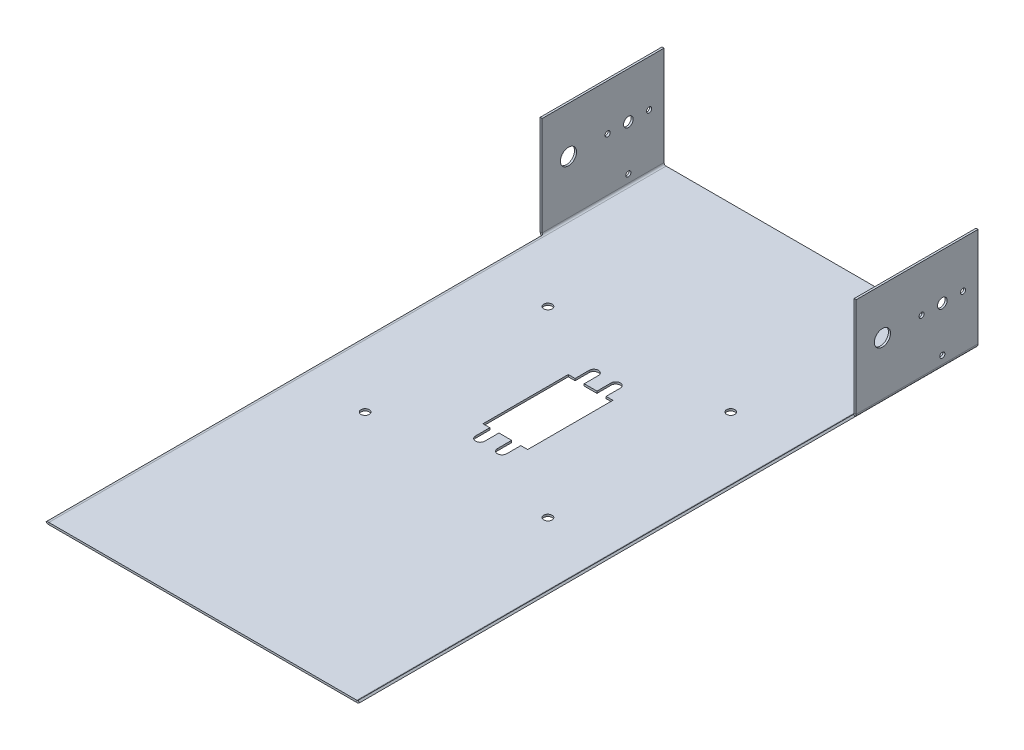
from build123d import *

# Parameters (mm, degrees)
SKETCH1_W                    = 154
SKETCH1_H                    = 304
BASE_FLANGE1_DEPTH           = 1
SKETCH4_W                    = 22
SKETCH4_H                    = 42
CUT_EXTRUDE3_DEPTH           = 10
MIRROR2_COPY_1_SKETCH_W      = 22
MIRROR2_COPY_1_SKETCH_H      = 42
MIRROR2_COPY_1_DEPTH         = 10
SKETCH2_R                    = 2.05
CUT_EXTRUDE4_DEPTH           = 10
SKETCH10_W                   = 50
SKETCH10_H                   = 60
BOSS_EXTRUDE2_DEPTH          = 1
SKETCH11_R                   = 3.975
SKETCH11_R_2                 = 1.27
SKETCH11_R_3                 = 2.375
CUT_EXTRUDE6_DEPTH           = 1
SKETCH12_R                   = 1.27
CUT_EXTRUDE7_DEPTH           = 1
SKETCH13_R                   = 3.975
SKETCH13_R_2                 = 1.27
SKETCH13_R_3                 = 2.375
CUT_EXTRUDE8_DEPTH           = 1
SKETCHED_START               = -127
SKETCHED_BEND1_OUTLINE_W     = 1
SKETCHED_BEND1_OUTLINE_H     = 60
SKETCHED_BEND1_DEPTH         = 49.366857245
SKETCHED_START_2             = -77.689070906
SKETCHED_BEND1_2_OUTLINE_W   = 49.821902755
SKETCHED_BEND1_2_OUTLINE_H   = 60
SKETCHED_BEND1_2_OUTLINE_R   = 1.27
SKETCHED_BEND1_2_OUTLINE_R_2 = 2.375
SKETCHED_BEND1_2_OUTLINE_R_3 = 3.975
SKETCHED_BEND1_2_DEPTH       = 0.867168151
SKETCHED_START_3             = -77
SKETCHED_BEND1_3_OUTLINE_W   = 49.821902755
SKETCHED_BEND1_3_OUTLINE_H   = 60
SKETCHED_BEND1_3_OUTLINE_R   = 1.27
SKETCHED_BEND1_3_OUTLINE_R_2 = 2.375
SKETCHED_BEND1_3_OUTLINE_R_3 = 3.975
SKETCHED_BEND1_3_DEPTH       = 1.178097245
SKETCHED_START_4             = -77.821902755
SKETCHED_BEND1_4_OUTLINE_W   = 49.821902755
SKETCHED_BEND1_4_OUTLINE_H   = 60
SKETCHED_BEND1_4_OUTLINE_R   = 1.27
SKETCHED_BEND1_4_OUTLINE_R_2 = 2.375
SKETCHED_BEND1_4_OUTLINE_R_3 = 3.975
SKETCHED_BEND1_4_DEPTH       = 0.132831849
SKETCHED_START_5             = -35
SKETCHED_BEND1_5_DEPTH       = 304.655376963
SKETCHED_START_6             = 25.655376963
SKETCHED_BEND1_6_DEPTH       = 244
SKETCHED_BEND1_7_DEPTH       = 244
SKETCHED_START_7             = 77.616422755
SKETCHED_BEND2_OUTLINE_W     = 1
SKETCHED_BEND2_OUTLINE_H     = 60
SKETCHED_BEND2_DEPTH         = 49.383577245
SKETCHED_START_8             = 76.821902755
SKETCHED_BEND2_2_OUTLINE_W   = 49.821902755
SKETCHED_BEND2_2_OUTLINE_H   = 60
SKETCHED_BEND2_2_OUTLINE_R   = 1.27
SKETCHED_BEND2_2_OUTLINE_R_2 = 2.375
SKETCHED_BEND2_2_OUTLINE_R_3 = 3.975
SKETCHED_BEND2_2_DEPTH       = 0.414213562
SKETCHED_START_9             = 75.821902755
SKETCHED_BEND2_3_OUTLINE_W   = 49.821902755
SKETCHED_BEND2_3_OUTLINE_H   = 60
SKETCHED_BEND2_3_OUTLINE_R   = 1.27
SKETCHED_BEND2_3_OUTLINE_R_2 = 2.375
SKETCHED_BEND2_3_OUTLINE_R_3 = 3.975
SKETCHED_BEND2_3_DEPTH       = 2
SKETCHED_BEND2_4_DEPTH       = 304.655376963
SKETCHED_BEND2_5_DEPTH       = 244
SKETCHED_BEND2_6_DEPTH       = 244


with BuildPart() as part:
    # Base-Flange1: sheet metal written as solids
    # Sketch1 → Base-Flange1 (new body)
    with BuildSketch(Plane(origin=(0, 0, 0), x_dir=(1, 0, 0), z_dir=(0, 1, 0))):
        with Locations((0, -117.655376963)):
            Rectangle(SKETCH1_W, SKETCH1_H)
    extrude(amount=-BASE_FLANGE1_DEPTH)

    # Sketch4 → Cut-Extrude3 (cut)
    with BuildSketch(Plane(origin=(0, 0, 0), x_dir=(1, 0, 0), z_dir=(0, 1, 0))):
        with Locations((0, -99.655376963)):
            Rectangle(SKETCH4_W, SKETCH4_H)
        with BuildLine():
            Line((-7.634176778, -85.655376963), (-7.634176778, -71.655376963))
            ThreePointArc((-7.634176778, -71.655376963), (-5.384176778, -69.405376963), (-3.134176778, -71.655376963))
            Line((-3.134176778, -71.655376963), (-3.134176778, -85.655376963))
            ThreePointArc((-3.134176778, -85.655376963), (-5.384176778, -87.905376963), (-7.634176778, -85.655376963))
        make_face()
    cut_extrude3 = extrude(amount=-CUT_EXTRUDE3_DEPTH, mode=Mode.SUBTRACT)

    # Mirror1: Cut-Extrude3 across plane
    add(cut_extrude3.mirror(Plane(origin=(0, 0, 0), x_dir=(0, 0, 1), z_dir=(1, 0, 0))), mode=Mode.SUBTRACT)

    # Mirror2: Cut-Extrude3 across plane
    add(cut_extrude3.mirror(Plane(origin=(0, 0, 99.655376963), x_dir=(1, 0, 0), z_dir=(0, 0, -1))), mode=Mode.SUBTRACT)

    # Mirror2 copy 1 sketch → Mirror2 copy 1 (cut)
    with BuildSketch(Plane(origin=(0, 0, 199.310753926), x_dir=(-1, 0, 0), z_dir=(0, 1, 0))):
        with Locations((0, -99.655376963)):
            Rectangle(MIRROR2_COPY_1_SKETCH_W, MIRROR2_COPY_1_SKETCH_H)
        with BuildLine():
            Line((-7.634176778, -85.655376963), (-7.634176778, -71.655376963))
            ThreePointArc((-7.634176778, -71.655376963), (-5.384176778, -69.405376963), (-3.134176778, -71.655376963))
            Line((-3.134176778, -71.655376963), (-3.134176778, -85.655376963))
            ThreePointArc((-3.134176778, -85.655376963), (-5.384176778, -87.905376963), (-7.634176778, -85.655376963))
        make_face()
    extrude(amount=-MIRROR2_COPY_1_DEPTH, mode=Mode.SUBTRACT)

    # Sketch2 → Cut-Extrude4 (cut)
    with BuildSketch(Plane(origin=(0, 0, 0), x_dir=(1, 0, 0), z_dir=(0, 1, 0))):
        with Locations(Location((-45.02, -144.67537696, 0), (0, 0, 270))):
            Circle(SKETCH2_R)
        with Locations(Location((-45.02, -54.63537696, 0), (0, 0, 270))):
            Circle(SKETCH2_R)
        with Locations(Location((45.02, -54.63537696, 0), (0, 0, 270))):
            Circle(SKETCH2_R)
        with Locations(Location((45.02, -144.67537696, 0), (0, 0, 270))):
            Circle(SKETCH2_R)
    extrude(amount=-CUT_EXTRUDE4_DEPTH, mode=Mode.SUBTRACT)

    # Sketch10 → Boss-Extrude2 (add)
    with BuildSketch(Plane(origin=(0, 0, 0), x_dir=(1, 0, 0), z_dir=(0, 1, 0))):
        with Locations((-102, 4.344623037)):
            Rectangle(SKETCH10_W, SKETCH10_H)
        with Locations((102, 4.344623037)):
            Rectangle(SKETCH10_W, SKETCH10_H)
    extrude(amount=-BOSS_EXTRUDE2_DEPTH)

    # Sketch11 → Cut-Extrude6 (cut)
    with BuildSketch(Plane(origin=(0, 0, 0), x_dir=(1, 0, 0), z_dir=(0, 1, 0))):
        with Locations(Location((104.29, -12.725376963, 0), (0, 0, 270))):
            Circle(SKETCH11_R)
        with Locations(Location((104.29, 6.564623037, 0), (0, 0, 270))):
            Circle(SKETCH11_R_2)
        with Locations(Location((104.29, 16.774623037, 0), (0, 0, 270))):
            Circle(SKETCH11_R_3)
        with Locations(Location((104.29, 26.984623037, 0), (0, 0, 270))):
            Circle(SKETCH11_R_2)
    extrude(amount=-CUT_EXTRUDE6_DEPTH, mode=Mode.SUBTRACT)

    # Sketch12 → Cut-Extrude7 (cut)
    with BuildSketch(Plane(origin=(0, 0, 0), x_dir=(1, 0, 0), z_dir=(0, 1, 0))):
        with Locations(Location((82.12, 16.774623037, 0), (0, 0, 270))):
            Circle(SKETCH12_R)
    extrude(amount=-CUT_EXTRUDE7_DEPTH, mode=Mode.SUBTRACT)

    # Sketch13 → Cut-Extrude8 (cut)
    with BuildSketch(Plane(origin=(0, 0, 0), x_dir=(1, 0, 0), z_dir=(0, 1, 0))):
        with Locations(Location((-104.29, -12.725376963, 0), (0, 0, 270))):
            Circle(SKETCH13_R)
        with Locations(Location((-104.29, 6.564623037, 0), (0, 0, 270))):
            Circle(SKETCH13_R_2)
        with Locations(Location((-104.29, 16.774623037, 0), (0, 0, 270))):
            Circle(SKETCH13_R_3)
        with Locations(Location((-82.12, 16.774623037, 0), (0, 0, 270))):
            Circle(SKETCH13_R_2)
        with Locations(Location((-104.29, 26.984623037, 0), (0, 0, 270))):
            Circle(SKETCH13_R_2)
    extrude(amount=-CUT_EXTRUDE8_DEPTH, mode=Mode.SUBTRACT)

    # Sketched Bend1: read off the stored shape, not the designer's step
    # Sketched Bend1 outline → Sketched Bend1 (cut)
    with BuildSketch(Plane.YZ.offset(SKETCHED_START)):
        with Locations((-0.5, -4.344623037)):
            Rectangle(SKETCHED_BEND1_OUTLINE_W, SKETCHED_BEND1_OUTLINE_H)
    extrude(amount=SKETCHED_BEND1_DEPTH, mode=Mode.SUBTRACT)

    # Sketched Bend1 2 outline → Sketched Bend1 2 (add)
    with BuildSketch(Plane.YZ.offset(SKETCHED_START_2)):
        with Locations((24.910951378, -4.344623037)):
            Rectangle(SKETCHED_BEND1_2_OUTLINE_W, SKETCHED_BEND1_2_OUTLINE_H)
        with Locations((4.941902755, -16.774623037)):
            Circle(SKETCHED_BEND1_2_OUTLINE_R, mode=Mode.SUBTRACT)
        with Locations((27.111902755, -26.984623037)):
            Circle(SKETCHED_BEND1_2_OUTLINE_R, mode=Mode.SUBTRACT)
        with Locations((27.111902755, -16.774623037)):
            Circle(SKETCHED_BEND1_2_OUTLINE_R_2, mode=Mode.SUBTRACT)
        with Locations((27.111902755, -6.564623037)):
            Circle(SKETCHED_BEND1_2_OUTLINE_R, mode=Mode.SUBTRACT)
        with Locations((27.111902755, 12.725376963)):
            Circle(SKETCHED_BEND1_2_OUTLINE_R_3, mode=Mode.SUBTRACT)
    extrude(amount=SKETCHED_BEND1_2_DEPTH)

    # Sketched Bend1 3 outline → Sketched Bend1 3 (add)
    with BuildSketch(Plane.YZ.offset(SKETCHED_START_3)):
        with Locations((24.910951378, -4.344623037)):
            Rectangle(SKETCHED_BEND1_3_OUTLINE_W, SKETCHED_BEND1_3_OUTLINE_H)
        with Locations((4.941902755, -16.774623037)):
            Circle(SKETCHED_BEND1_3_OUTLINE_R, mode=Mode.SUBTRACT)
        with Locations((27.111902755, -26.984623037)):
            Circle(SKETCHED_BEND1_3_OUTLINE_R, mode=Mode.SUBTRACT)
        with Locations((27.111902755, -16.774623037)):
            Circle(SKETCHED_BEND1_3_OUTLINE_R_2, mode=Mode.SUBTRACT)
        with Locations((27.111902755, -6.564623037)):
            Circle(SKETCHED_BEND1_3_OUTLINE_R, mode=Mode.SUBTRACT)
        with Locations((27.111902755, 12.725376963)):
            Circle(SKETCHED_BEND1_3_OUTLINE_R_3, mode=Mode.SUBTRACT)
    extrude(amount=SKETCHED_BEND1_3_DEPTH)

    # Sketched Bend1 4 outline → Sketched Bend1 4 (add)
    with BuildSketch(Plane.YZ.offset(SKETCHED_START_4)):
        with Locations((24.910951378, -4.344623037)):
            Rectangle(SKETCHED_BEND1_4_OUTLINE_W, SKETCHED_BEND1_4_OUTLINE_H)
        with Locations((4.941902755, -16.774623037)):
            Circle(SKETCHED_BEND1_4_OUTLINE_R, mode=Mode.SUBTRACT)
        with Locations((27.111902755, -26.984623037)):
            Circle(SKETCHED_BEND1_4_OUTLINE_R, mode=Mode.SUBTRACT)
        with Locations((27.111902755, -16.774623037)):
            Circle(SKETCHED_BEND1_4_OUTLINE_R_2, mode=Mode.SUBTRACT)
        with Locations((27.111902755, -6.564623037)):
            Circle(SKETCHED_BEND1_4_OUTLINE_R, mode=Mode.SUBTRACT)
        with Locations((27.111902755, 12.725376963)):
            Circle(SKETCHED_BEND1_4_OUTLINE_R_3, mode=Mode.SUBTRACT)
    extrude(amount=SKETCHED_BEND1_4_DEPTH)

    # Sketched Bend1 5 outline → Sketched Bend1 5 (cut)
    with BuildSketch(Plane.XY.offset(SKETCHED_START_5)):
        with BuildLine():
            Line((-76.821902755, 49.821902755), (-76.821902755, 1))
            ThreePointArc((-76.821902755, 1), (-76.529009536, 0.292893219), (-75.821902755, 0))
            Line((-75.821902755, 0), (-75.821902755, 49.821902755))
            Line((-75.821902755, 49.821902755), (-76.821902755, 49.821902755))
        make_face()
        with BuildLine():
            Line((-77.821902755, 1), (-77.821902755, 0))
            Line((-77.821902755, 0), (-77.633142755, 0))
            Line((-77.633142755, 0), (-77.633142755, -1))
            Line((-77.633142755, -1), (-75.821902755, -1))
            ThreePointArc((-75.821902755, -1), (-77.236116317, -0.414213562), (-77.821902755, 1))
        make_face()
    extrude(amount=SKETCHED_BEND1_5_DEPTH, mode=Mode.SUBTRACT)

    # Sketched Bend1 6 outline → Sketched Bend1 6 (cut)
    with BuildSketch(Plane.XY.offset(SKETCHED_START_6)):
        Polygon((-77, -0.178097245), (-76.821902755, 0), (-77, 0), align=None)
    extrude(amount=SKETCHED_BEND1_6_DEPTH, mode=Mode.SUBTRACT)

    # Sketched Bend1 7 outline → Sketched Bend1 7 (add)
    with BuildSketch(Plane.XY.offset(SKETCHED_START_6)):
        with BuildLine():
            ThreePointArc((-75.821902755, 0), (-76.204586187, 0.076120468), (-76.529009536, 0.292893219))
            Line((-76.529009536, 0.292893219), (-76.821902755, 0))
            Line((-76.821902755, 0), (-75.821902755, 0))
        make_face()
        with BuildLine():
            Line((-77, -0.616195186), (-77, -0.178097245))
            Line((-77, -0.178097245), (-77.236116317, -0.414213562))
            ThreePointArc((-77.236116317, -0.414213562), (-77.121986588, -0.519796705), (-77, -0.616195186))
        make_face()
    extrude(amount=SKETCHED_BEND1_7_DEPTH)

    # Sketched Bend2: read off the stored shape, not the designer's step
    # Sketched Bend2 outline → Sketched Bend2 (cut)
    with BuildSketch(Plane.YZ.offset(SKETCHED_START_7)):
        with Locations((-0.5, -4.344623037)):
            Rectangle(SKETCHED_BEND2_OUTLINE_W, SKETCHED_BEND2_OUTLINE_H)
    extrude(amount=SKETCHED_BEND2_DEPTH, mode=Mode.SUBTRACT)

    # Sketched Bend2 2 outline → Sketched Bend2 2 (add)
    with BuildSketch(Plane.YZ.offset(SKETCHED_START_8)):
        with Locations((24.910951378, -4.344623037)):
            Rectangle(SKETCHED_BEND2_2_OUTLINE_W, SKETCHED_BEND2_2_OUTLINE_H)
        with Locations((4.941902755, -16.774623037)):
            Circle(SKETCHED_BEND2_2_OUTLINE_R, mode=Mode.SUBTRACT)
        with Locations((27.111902755, -26.984623037)):
            Circle(SKETCHED_BEND2_2_OUTLINE_R, mode=Mode.SUBTRACT)
        with Locations((27.111902755, -16.774623037)):
            Circle(SKETCHED_BEND2_2_OUTLINE_R_2, mode=Mode.SUBTRACT)
        with Locations((27.111902755, -6.564623037)):
            Circle(SKETCHED_BEND2_2_OUTLINE_R, mode=Mode.SUBTRACT)
        with Locations((27.111902755, 12.725376963)):
            Circle(SKETCHED_BEND2_2_OUTLINE_R_3, mode=Mode.SUBTRACT)
    extrude(amount=SKETCHED_BEND2_2_DEPTH)

    # Sketched Bend2 3 outline → Sketched Bend2 3 (add)
    with BuildSketch(Plane.YZ.offset(SKETCHED_START_9)):
        with Locations((24.910951378, -4.344623037)):
            Rectangle(SKETCHED_BEND2_3_OUTLINE_W, SKETCHED_BEND2_3_OUTLINE_H)
        with Locations((4.941902755, -16.774623037)):
            Circle(SKETCHED_BEND2_3_OUTLINE_R, mode=Mode.SUBTRACT)
        with Locations((27.111902755, -26.984623037)):
            Circle(SKETCHED_BEND2_3_OUTLINE_R, mode=Mode.SUBTRACT)
        with Locations((27.111902755, -16.774623037)):
            Circle(SKETCHED_BEND2_3_OUTLINE_R_2, mode=Mode.SUBTRACT)
        with Locations((27.111902755, -6.564623037)):
            Circle(SKETCHED_BEND2_3_OUTLINE_R, mode=Mode.SUBTRACT)
        with Locations((27.111902755, 12.725376963)):
            Circle(SKETCHED_BEND2_3_OUTLINE_R_3, mode=Mode.SUBTRACT)
    extrude(amount=SKETCHED_BEND2_3_DEPTH)

    # Sketched Bend2 4 outline → Sketched Bend2 4 (cut)
    with BuildSketch(Plane.XY.offset(SKETCHED_START_5)):
        with BuildLine():
            ThreePointArc((77.821902755, 1), (77.236116317, -0.414213562), (75.821902755, -1))
            Line((75.821902755, -1), (77.616422755, -1))
            Line((77.616422755, -1), (77.616422755, 0))
            Line((77.616422755, 0), (77.821902755, 0))
            Line((77.821902755, 0), (77.821902755, 1))
        make_face()
        with BuildLine():
            ThreePointArc((75.821902755, 0), (76.529009536, 0.292893219), (76.821902755, 1))
            Line((76.821902755, 1), (76.821902755, 49.821902755))
            Line((76.821902755, 49.821902755), (75.821902755, 49.821902755))
            Line((75.821902755, 49.821902755), (75.821902755, 0))
        make_face()
    extrude(amount=SKETCHED_BEND2_4_DEPTH, mode=Mode.SUBTRACT)

    # Sketched Bend2 5 outline → Sketched Bend2 5 (cut)
    with BuildSketch(Plane.XY.offset(SKETCHED_START_6)):
        Polygon((76.821902755, 0), (77, -0.178097245), (77, 0), align=None)
    extrude(amount=SKETCHED_BEND2_5_DEPTH, mode=Mode.SUBTRACT)

    # Sketched Bend2 6 outline → Sketched Bend2 6 (add)
    with BuildSketch(Plane.XY.offset(SKETCHED_START_6)):
        with BuildLine():
            ThreePointArc((77, -0.616195186), (77.121986588, -0.519796705), (77.236116317, -0.414213562))
            Line((77.236116317, -0.414213562), (77, -0.178097245))
            Line((77, -0.178097245), (77, -0.616195186))
        make_face()
        with BuildLine():
            Line((75.821902755, 0), (76.821902755, 0))
            Line((76.821902755, 0), (76.529009536, 0.292893219))
            ThreePointArc((76.529009536, 0.292893219), (76.204586187, 0.076120468), (75.821902755, 0))
        make_face()
    extrude(amount=SKETCHED_BEND2_6_DEPTH)


solid = part.part
